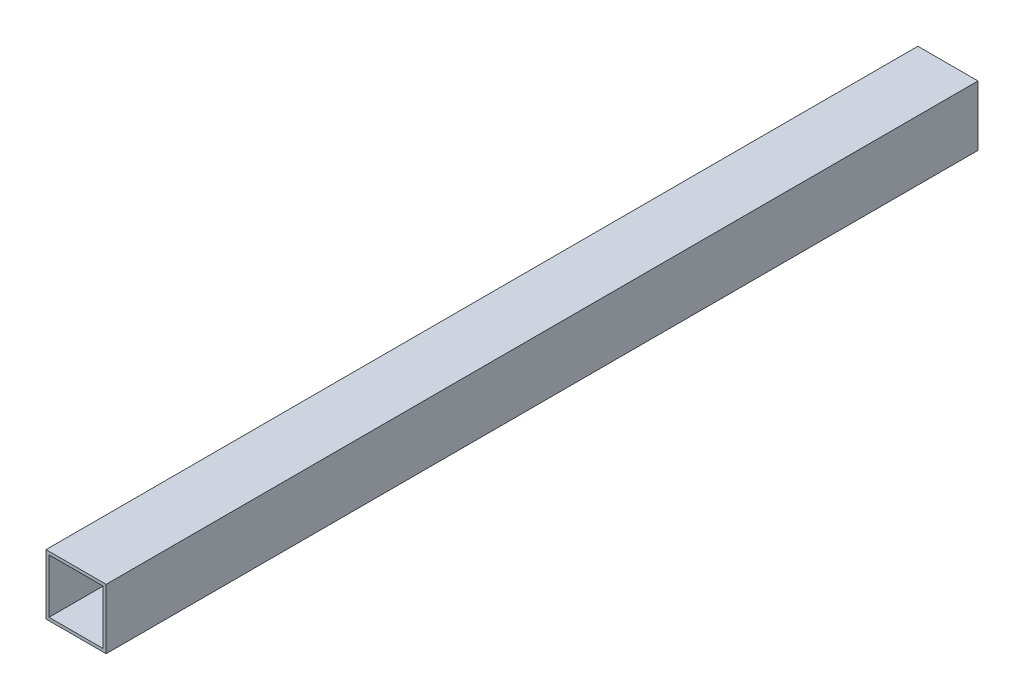
from build123d import *

# Parameters (mm, degrees)
SKETCH_1_W      = 20
SKETCH_1_H      = 20
SKETCH_1_W_2    = 18
SKETCH_1_H_2    = 18
EXTRUDE_1_DEPTH = 290


with BuildPart() as part:
    # 草图1 → 拉伸-薄壁1 (new body)
    with BuildSketch(Plane.XY):
        with Locations((10, -10)):
            Rectangle(SKETCH_1_W, SKETCH_1_H)
        with Locations((10, -10)):
            Rectangle(SKETCH_1_W_2, SKETCH_1_H_2, mode=Mode.SUBTRACT)
    extrude(amount=EXTRUDE_1_DEPTH)


solid = part.part
